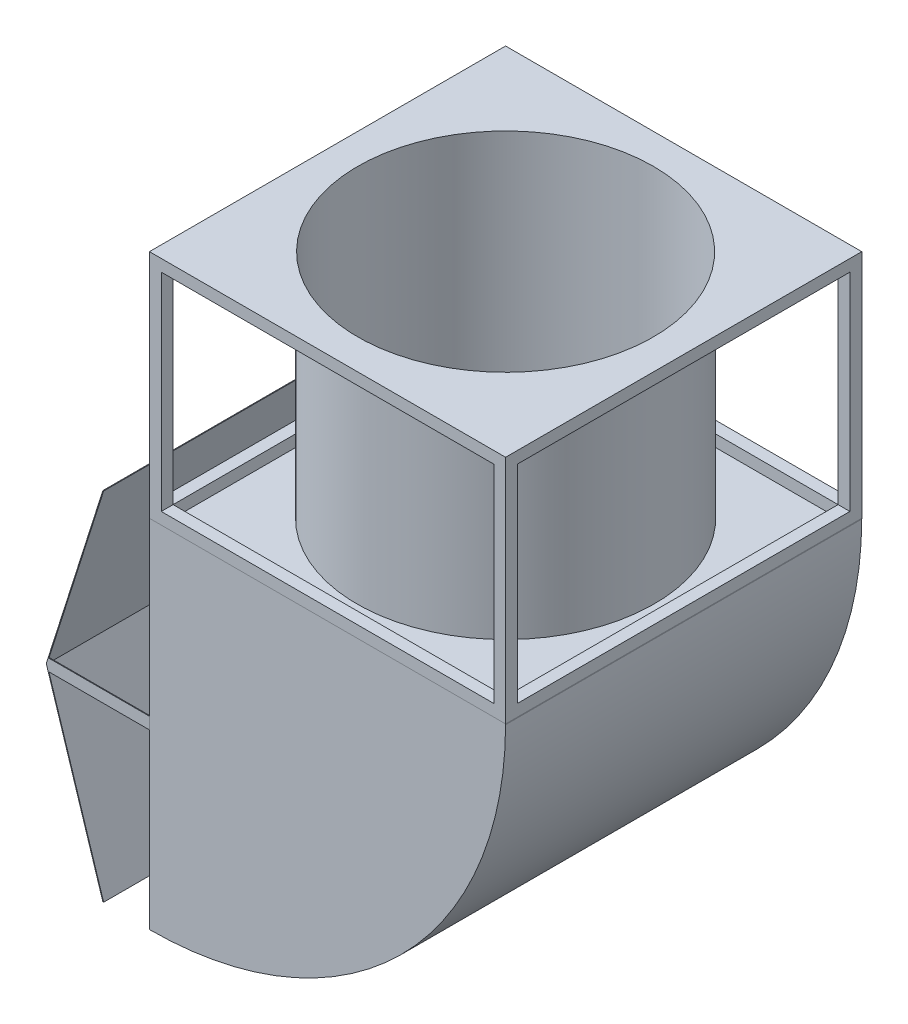
from build123d import *

# Parameters (mm, degrees)
SKETCH1_W           = 765
SKETCH1_H           = 765
SKETCH1_W_2         = 714.2
SKETCH1_H_2         = 714.2
BOSS_EXTRUDE1_DEPTH = 496
SKETCH3_W           = 714.2
SKETCH3_H           = 445.2
CUT_EXTRUDE1_DEPTH  = 989.709891728
SKETCH4_W           = 714.2
SKETCH4_H           = 445.2
CUT_EXTRUDE2_DEPTH  = 989.709891728
SKETCH2_R           = 319.0875
SKETCH2_R_2         = 317.5
BOSS_EXTRUDE2_DEPTH = 496
SKETCH5_W           = 765
SKETCH5_H           = 765
SKETCH5_R           = 319.0875
BOSS_EXTRUDE3_DEPTH = 1.5875
SWEEP1_START        = -382.5
SWEEP1_DEPTH        = 765
SHELL2_T            = -1.5875
BOSS_EXTRUDE4_START = 1.5875
SKETCH11_W          = 765
SKETCH11_H          = 765
SKETCH11_R          = 319.0875
BOSS_EXTRUDE4_DEPTH = 1.5875
BOSS_EXTRUDE5_DEPTH = 254
BOSS_EXTRUDE6_DEPTH = 761.825
BOSS_EXTRUDE7_REACH = 1293.876
SKETCH14_W          = 1.5875
SKETCH14_H          = 25.4


# Read off the part's stored shape, not the designer's step: Sweep1
with BuildPart() as part:
    # Sketch1 → Boss-Extrude1 (new body)
    with BuildSketch(Plane(origin=(0, 0, 0), x_dir=(1, 0, 0), z_dir=(0, 1, 0))):
        Rectangle(SKETCH1_W, SKETCH1_H)
        Rectangle(SKETCH1_W_2, SKETCH1_H_2, mode=Mode.SUBTRACT)
    extrude(amount=BOSS_EXTRUDE1_DEPTH)

    # Sketch3 → Cut-Extrude1 (cut, through all)
    with BuildSketch(Plane(origin=(382.5, 0, 0), x_dir=(0, 0, -1), z_dir=(1, 0, 0))):
        with Locations((0, 248)):
            Rectangle(SKETCH3_W, SKETCH3_H)
    extrude(amount=-CUT_EXTRUDE1_DEPTH, mode=Mode.SUBTRACT)

    # Sketch4 → Cut-Extrude2 (cut, through all)
    with BuildSketch(Plane.XY.offset(382.5)):
        with Locations((0, 248)):
            Rectangle(SKETCH4_W, SKETCH4_H)
    extrude(amount=-CUT_EXTRUDE2_DEPTH, mode=Mode.SUBTRACT)



with BuildPart() as body_2:
    # Sketch2 → Boss-Extrude2 (new body)
    with BuildSketch(Plane.XZ):
        with Locations(Location((0, 0, 0), (0, 0, 270))):
            Circle(SKETCH2_R)
        with Locations(Location((0, 0, 0), (0, 0, 270))):
            Circle(SKETCH2_R_2, mode=Mode.SUBTRACT)
    extrude(amount=-BOSS_EXTRUDE2_DEPTH)


with BuildPart() as part_1:
    add(part.part)

    add(body_2.part)  # Boss-Extrude3 merges body 2
    # Sketch5 → Boss-Extrude3 (add)
    with BuildSketch(Plane(origin=(0, 496, 0), x_dir=(1, 0, 0), z_dir=(0, 1, 0))):
        Rectangle(SKETCH5_W, SKETCH5_H)
        with Locations(Location((0, 0, 0), (0, 0, 90))):
            Circle(SKETCH5_R, mode=Mode.SUBTRACT)
    extrude(amount=-BOSS_EXTRUDE3_DEPTH)


with BuildPart() as body_2_2:
    # Sweep1 outline → Sweep1 (new body)
    with BuildSketch(Plane.XY.offset(SWEEP1_START)):
        with BuildLine():
            ThreePointArc((-382.5, -765), (158.436687608, -540.936687608), (382.5, 0))
            Line((382.5, 0), (-382.5, 0))
            Line((-382.5, 0), (-382.5, -765))
        make_face()
    extrude(amount=SWEEP1_DEPTH)

    # Shell2
    shell2_openings = [body_2_2.faces().sort_by_distance(p)[0] for p in [
        (-382.5, -382.5, 0),
        (0, 0, 0),
    ]]
    offset(amount=SHELL2_T, openings=shell2_openings, kind=Kind.INTERSECTION)

    # Sketch11 → Boss-Extrude4 (add)
    with BuildSketch(Plane.XZ.offset(BOSS_EXTRUDE4_START)):
        Rectangle(SKETCH11_W, SKETCH11_H)
        with Locations(Location((0, 0, 0), (0, 0, 270))):
            Circle(SKETCH11_R, mode=Mode.SUBTRACT)
    extrude(amount=-BOSS_EXTRUDE4_DEPTH)

    # Sketch12 → Boss-Extrude5 (add)
    with BuildSketch(Plane.ZY.offset(331.7)):
        Polygon((-380.9125, -382.5), (-380.9125, -369.8), (-379.325, -369.8), (-379.325, -395.2), (-380.9125, -395.2), align=None)
        Polygon((380.9125, -369.8), (379.325, -369.8), (379.325, -395.2), (380.9125, -395.2), (380.9125, -382.5), align=None)
    extrude(amount=BOSS_EXTRUDE5_DEPTH)


with BuildPart() as body_3:
    # Sketch13 → Boss-Extrude6 (new body)
    with BuildSketch(Plane(origin=(0, 0, -380.9125), x_dir=(-1, 0, 0), z_dir=(0, 0, -1))):
        Polygon((605.7, -382.5), (484.1, -765), (482.43420953, -765), (604.03420953, -382.5), (482.43420953, 0), (484.1, 0), align=None)
    extrude(amount=-BOSS_EXTRUDE6_DEPTH)

    # Sketch14 → Boss-Extrude7 (add, up to next)
    with BuildSketch(Plane.ZY.offset(585.7), mode=Mode.PRIVATE) as boss_extrude7_sk1:
        with Locations((380.11875, -382.5)):
            Rectangle(SKETCH14_W, SKETCH14_H)
    boss_extrude7_tool1 = extrude(boss_extrude7_sk1.sketch, amount=BOSS_EXTRUDE7_REACH, mode=Mode.PRIVATE) - body_3.part
    # Sketch14 → Boss-Extrude7 (add, up to next)
    with BuildSketch(Plane.ZY.offset(585.7), mode=Mode.PRIVATE) as boss_extrude7_sk2:
        with Locations((-380.11875, -382.5)):
            Rectangle(SKETCH14_W, SKETCH14_H)
    boss_extrude7_tool2 = extrude(boss_extrude7_sk2.sketch, amount=BOSS_EXTRUDE7_REACH, mode=Mode.PRIVATE) - body_3.part

    add(body_2_2.part)  # Boss-Extrude7 merges body 2 2
    add(boss_extrude7_tool1.solids().sort_by_distance((-585.7, -382.5, 380.11875))[0])
    add(boss_extrude7_tool2.solids().sort_by_distance((-585.7, -382.5, -380.11875))[0])


solid = Compound([part_1.part, body_3.part])
